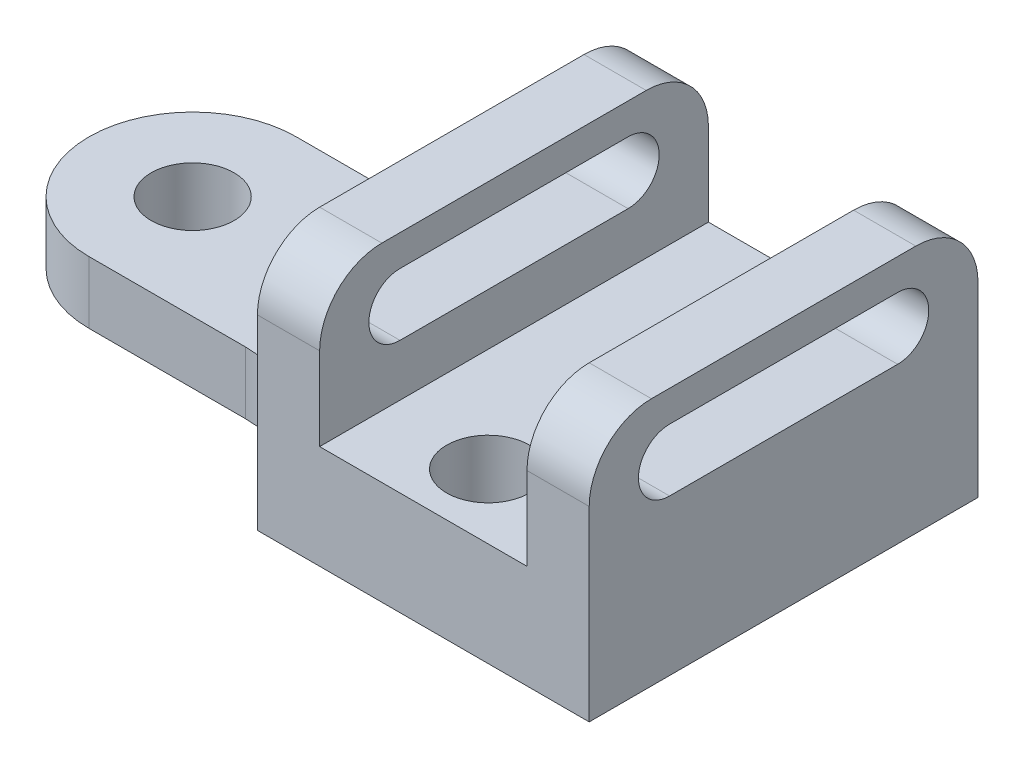
from build123d import *

# Parameters (mm, degrees)
SKETCH2_W           = 70
SKETCH2_H           = 12
BOSS_EXTRUDE2_DEPTH = 75
CUT_EXTRUDE2_DEPTH  = 75
FILLET2_R           = 20
SKETCH11_R          = 8
CUT_EXTRUDE9_DEPTH  = 20
SKETCH13_R          = 8
CUT_EXTRUDE10_DEPTH = 107.343782141
CUT_EXTRUDE11_DEPTH = 161.888159912
FILLET3_R           = 12


with BuildPart() as part:
    # Sketch2 → Boss-Extrude2 (new body)
    with BuildSketch(Plane.XY):
        Polygon((12, 48), (0, 48), (0, 0), (64, 0), (64, 48), (52, 48), (52, 20), (12, 20), align=None)
        with Locations((-35, 6)):
            Rectangle(SKETCH2_W, SKETCH2_H)
    extrude(amount=-BOSS_EXTRUDE2_DEPTH)

    # Sketch4 → Cut-Extrude2 (cut)
    with BuildSketch(Plane(origin=(0, 12, 0), x_dir=(1, 0, 0), z_dir=(0, 1, 0))):
        with BuildLine():
            ThreePointArc((-70, 37.5), (-64.142135624, 51.642135624), (-50, 57.5))
            Line((-50, 57.5), (0, 57.5))
            Line((0, 57.5), (0, 75))
            Line((0, 75), (-70, 75))
            Line((-70, 75), (-70, 37.5))
        make_face()
        with BuildLine():
            ThreePointArc((-50, 17.5), (-64.142135624, 23.357864376), (-70, 37.5))
            Line((-70, 37.5), (-70, 0))
            Line((-70, 0), (0, 0))
            Line((0, 0), (0, 17.5))
            Line((0, 17.5), (-50, 17.5))
        make_face()
    extrude(amount=-CUT_EXTRUDE2_DEPTH, mode=Mode.SUBTRACT)

    # Fillet2
    # the kernel refuses this fillet: 20 mm, written as the material it adds along each edge
    with BuildSketch(Plane(origin=(0, 12, -57.5), x_dir=(-1, 0, 0), z_dir=(0, -1, 0))) as fillet2_piece_1:
        with BuildLine():
            CenterArc((19.843134833, 20), FILLET2_R, 187.180755781, 82.819244219)
            Line((0, 17.5), (-0.396862697, 17.45))
            ThreePointArc((-0.396862697, 17.45), (-0.4, 8.75), (-0.4, 0))
            Line((-0.4, 0), (0, -0.4))
            Line((0, -0.4), (19.843134833, -0.4))
            Line((19.843134833, -0.4), (19.843134833, 0))
        make_face()
    extrude(amount=12)
    with BuildSketch(Plane(origin=(0, 12, -17.5), x_dir=(-1, 0, 0), z_dir=(0, -1, 0))) as fillet2_piece_2:
        with BuildLine():
            CenterArc((19.843134833, -20), FILLET2_R, 90, 82.819244219)
            Line((0, -17.5), (-0.396862697, -17.45))
            ThreePointArc((-0.396862697, -17.45), (-0.4, -8.75), (-0.4, 0))
            Line((-0.4, 0), (0, 0.4))
            Line((0, 0.4), (19.843134833, 0.4))
            Line((19.843134833, 0.4), (19.843134833, 0))
        make_face()
    extrude(amount=12)

    # Sketch11 → Cut-Extrude9 (cut)
    with BuildSketch(Plane(origin=(0, 12, 0), x_dir=(1, 0, 0), z_dir=(0, 1, 0))):
        with Locations(Location((-50, 37.5, 0), (0, 0, 180))):
            Circle(SKETCH11_R)
    extrude(amount=-CUT_EXTRUDE9_DEPTH, mode=Mode.SUBTRACT)

    # Sketch13 → Cut-Extrude10 (cut, through all)
    with BuildSketch(Plane(origin=(0, 20, 0), x_dir=(1, 0, 0), z_dir=(0, 1, 0))):
        with Locations(Location((32, 62.5, 0), (0, 0, 180))):
            Circle(SKETCH13_R)
        with Locations(Location((32, 12.5, 0), (0, 0, 180))):
            Circle(SKETCH13_R)
    extrude(amount=-CUT_EXTRUDE10_DEPTH, mode=Mode.SUBTRACT)

    # Sketch14 → Cut-Extrude11 (cut, through all)
    with BuildSketch(Plane(origin=(64, 0, 0), x_dir=(0, 0, -1), z_dir=(1, 0, 0))):
        with BuildLine():
            Line((15.5, 42), (59.5, 42))
            ThreePointArc((59.5, 42), (65.5, 36), (59.5, 30))
            Line((59.5, 30), (15.5, 30))
            ThreePointArc((15.5, 30), (9.5, 36), (15.5, 42))
        make_face()
    extrude(amount=-CUT_EXTRUDE11_DEPTH, mode=Mode.SUBTRACT)

    # Fillet3
    fillet3_edges = [part.edges().sort_by_distance(p)[0] for p in [
        (58, 48, 0),
        (6, 48, 0),
        (6, 48, -75),
        (58, 48, -75),
    ]]
    fillet(fillet3_edges, radius=FILLET3_R)


solid = part.part
